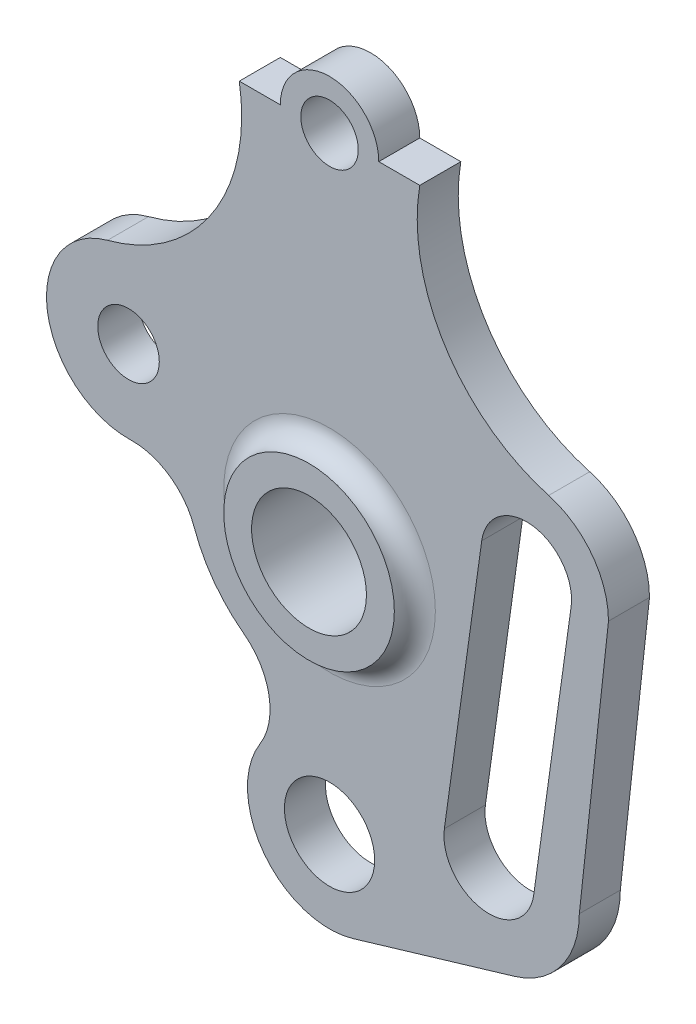
from build123d import *

# Parameters (mm, degrees)
SKETCH1_R           = 20.799200533
SKETCH1_R_2         = 14
BOSS_EXTRUDE2_DEPTH = 10
SKETCH1_5_R         = 11
SKETCH1_5_R_2       = 20.799200533
SKETCH1_5_R_3       = 7.5
SKETCH1_5_R_4       = 7
BOSS_EXTRUDE3_DEPTH = 5
FILLET1_R           = 5


with BuildPart() as part:
    # Sketch1 → Boss-Extrude2 (new, symmetric)
    with BuildSketch(Plane.XY):
        Circle(SKETCH1_R)
        Circle(SKETCH1_R_2, mode=Mode.SUBTRACT)
    extrude(amount=BOSS_EXTRUDE2_DEPTH, both=True)

    # Sketch1<5> → Boss-Extrude3 (add, symmetric)
    with BuildSketch(Plane.XY):
        with BuildLine():
            Line((67.531815598, 14.697886629), (68, 19))
            ThreePointArc((68, 19), (63.946467856, 31.071046472), (53.428983707, 38.249055455))
            ThreePointArc((53.428983707, 38.249055455), (28.173712308, 57.097365678), (22, 88))
            Line((22, 88), (12, 88))
            ThreePointArc((12, 88), (0, 100), (-12, 88))
            Line((-12, 88), (-22, 88))
            ThreePointArc((-22, 88), (-28.472570597, 56.960167242), (-54.130188439, 38.330834606))
            ThreePointArc((-54.130188439, 38.330834606), (-68.797617118, 16.161980188), (-48.492972379, -0.993572042))
            ThreePointArc((-48.492972379, -0.993572042), (-39.014510451, -3.809523143), (-33.001122743, -11.658726248))
            ThreePointArc((-33.001122743, -11.658726248), (-28.18429152, -20.752004999), (-20.931196761, -28.051470588))
            ThreePointArc((-20.931196761, -28.051470588), (-14.77228566, -37.934411824), (-16.94430214, -49.375))
            ThreePointArc((-16.94430214, -49.375), (-15.922624494, -72.102480293), (5.70222012, -79.169890081))
            Line((5.70222012, -79.169890081), (45.161092518, -67.432567897))
            ThreePointArc((45.161092518, -67.432567897), (56.523753546, -59.49875448), (60.888650386, -46.345688809))
            Line((60.888650386, -46.345688809), (67.531815598, 14.697886629))
        make_face()
        with Locations((0, -60)):
            Circle(SKETCH1_5_R, mode=Mode.SUBTRACT)
        Circle(SKETCH1_5_R_2, mode=Mode.SUBTRACT)
        with BuildLine():
            ThreePointArc((37.105394377, 20.519068244), (49.519068244, 29.894605623), (58.894605623, 17.480931756))
            Line((58.894605623, 17.480931756), (49.783256009, -47.864757052))
            ThreePointArc((49.783256009, -47.864757052), (37.369582142, -57.240294431), (27.994044763, -44.826620565))
            Line((27.994044763, -44.826620565), (37.105394377, 20.519068244))
        make_face(mode=Mode.SUBTRACT)
        with Locations((-49, 19)):
            Circle(SKETCH1_5_R_3, mode=Mode.SUBTRACT)
        with Locations((0, 88)):
            Circle(SKETCH1_5_R_4, mode=Mode.SUBTRACT)
    extrude(amount=BOSS_EXTRUDE3_DEPTH, both=True)

    # Fillet1
    fillet1_edges = [part.edges().sort_by_distance(p)[0] for p in [
        (-20.799200533, 0, 5),
    ]]
    fillet(fillet1_edges, radius=FILLET1_R - 0.0001)  # a hair under: the kernel refuses the full size


solid = part.part
